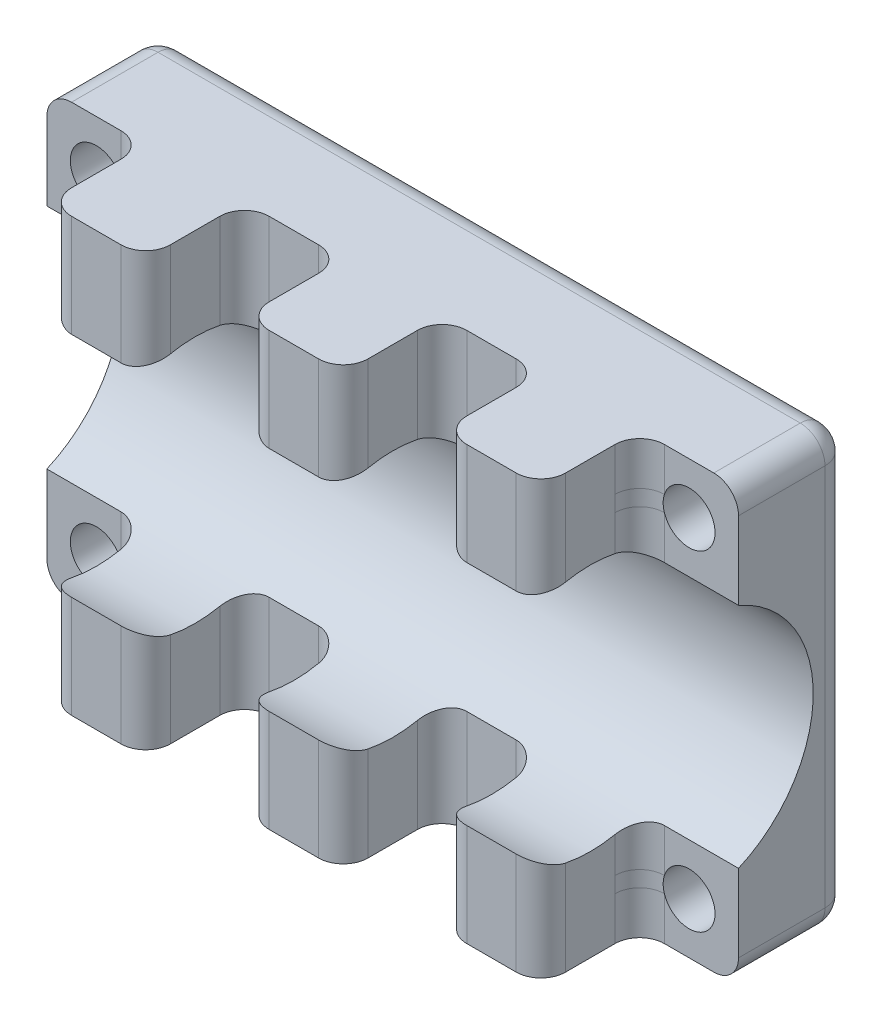
from build123d import *

# Parameters (mm, degrees)
SKETCH_1_W          = 56
SKETCH_1_H          = 35
EXTRUDE_1_DEPTH     = 26
SKETCH_2_R          = 10.05
CUT_EXTRUDE_1_DEPTH = 73
CUT_EXTRUDE_6_DEPTH = 41
SKETCH_6_R          = 2.1
CUT_EXTRUDE_7_DEPTH = 41
FILLET_3_R          = 2
FILLET_4_R          = 2


with BuildPart() as part:
    # 草图1 → 凸台-拉伸1 (new body)
    with BuildSketch(Plane.XY):
        with Locations((28, -17.5)):
            Rectangle(SKETCH_1_W, SKETCH_1_H)
    extrude(amount=EXTRUDE_1_DEPTH)

    # 草图2 → 切除-拉伸1 (cut)
    with BuildSketch(Plane(origin=(56, 0, 0), x_dir=(0, 0, -1), z_dir=(1, 0, 0))):
        with Locations(Location((-13, -17.5, 0), (0, 0, 90))):
            Circle(SKETCH_2_R)
    extrude(amount=-CUT_EXTRUDE_1_DEPTH, mode=Mode.SUBTRACT)

    # 草图3 → 切除-拉伸6 (cut)
    with BuildSketch(Plane(origin=(0, 0, 0), x_dir=(1, 0, 0), z_dir=(0, 1, 0))):
        Polygon((8, -9), (0, -9), (0, -26), (56, -26), (56, -9), (48, -9), (48, -17), (40, -17), (40, -9), (32, -9), (32, -17), (24, -17), (24, -9), (16, -9), (16, -17), (8, -17), align=None)
    extrude(amount=-CUT_EXTRUDE_6_DEPTH, mode=Mode.SUBTRACT)

    # 草图6 → 切除-拉伸7 (cut)
    with BuildSketch(Plane(origin=(0, 0, 0), x_dir=(-1, 0, 0), z_dir=(0, 0, -1))):
        with Locations((-4, -4.140159981)):
            Circle(SKETCH_6_R)
        with Locations((-52, -4.140159981)):
            Circle(SKETCH_6_R)
        with Locations(Location((-4, -30.859840019, 0), (0, 0, 180))):
            Circle(SKETCH_6_R)
        with Locations(Location((-52, -30.859840019, 0), (0, 0, 180))):
            Circle(SKETCH_6_R)
    extrude(amount=-CUT_EXTRUDE_7_DEPTH, mode=Mode.SUBTRACT)

    # 圆角3
    fillet_3_edges = [part.edges().sort_by_distance(p)[0] for p in [
        (48, -30.859840019, 9),
        (48, -4.140159981, 9),
        (8, -30.859840019, 9),
        (8, -4.140159981, 9),
        (8, -30.859840019, 17),
        (8, -4.140159981, 17),
        (16, -30.859840019, 17),
        (16, -4.140159981, 17),
        (16, -30.859840019, 9),
        (16, -4.140159981, 9),
        (24, -30.859840019, 9),
        (24, -4.140159981, 9),
        (24, -30.859840019, 17),
        (24, -4.140159981, 17),
        (32, -30.859840019, 17),
        (32, -4.140159981, 17),
        (32, -30.859840019, 9),
        (32, -4.140159981, 9),
        (40, -30.859840019, 9),
        (40, -4.140159981, 9),
        (40, -30.859840019, 17),
        (40, -4.140159981, 17),
        (48, -30.859840019, 17),
        (48, -4.140159981, 17),
    ]]
    fillet(fillet_3_edges, radius=FILLET_3_R)

    # 圆角4
    # the kernel refuses this fillet: 2 mm, written as the material it takes off along each edge
    with BuildSketch(Plane(origin=(2, -2, 2), x_dir=(0, 0, -1), z_dir=(0, 1, 0))) as fillet_4_piece_1_section:
        Polygon((0, 0), (FILLET_4_R, 0), (FILLET_4_R, FILLET_4_R), (0, FILLET_4_R), align=None)
    fillet_4_piece_1 = extrude(amount=FILLET_4_R, mode=Mode.PRIVATE)
    fillet_4_piece_1 = fillet_4_piece_1 - Plane(origin=(2, -2, 2), x_dir=(0.7071067811865475, 0, 0.7071067811865475), z_dir=(0, 1, 0)) * Sphere(FILLET_4_R, mode=Mode.PRIVATE)
    add(fillet_4_piece_1, mode=Mode.SUBTRACT)
    with BuildSketch(Plane(origin=(54, -2, 2), x_dir=(1, 0, 0), z_dir=(0, 1, 0))) as fillet_4_piece_2_section:
        Polygon((0, 0), (FILLET_4_R, 0), (FILLET_4_R, FILLET_4_R), (0, FILLET_4_R), align=None)
    fillet_4_piece_2 = extrude(amount=FILLET_4_R, mode=Mode.PRIVATE)
    fillet_4_piece_2 = fillet_4_piece_2 - Plane(origin=(54, -2, 2), x_dir=(-0.7071067811865475, 0, 0.7071067811865475), z_dir=(0, 1, 0)) * Sphere(FILLET_4_R, mode=Mode.PRIVATE)
    add(fillet_4_piece_2, mode=Mode.SUBTRACT)
    with BuildSketch(Plane(origin=(54, -33, 2), x_dir=(1, 0, 0), z_dir=(0, -1, 0))) as fillet_4_piece_3_section:
        Polygon((0, 0), (FILLET_4_R, 0), (FILLET_4_R, -FILLET_4_R), (0, -FILLET_4_R), align=None)
    fillet_4_piece_3 = extrude(amount=FILLET_4_R, mode=Mode.PRIVATE)
    fillet_4_piece_3 = fillet_4_piece_3 - Plane(origin=(54, -33, 2), x_dir=(-0.7071067811865475, 0, 0.7071067811865475), z_dir=(0, -1, 0)) * Sphere(FILLET_4_R, mode=Mode.PRIVATE)
    add(fillet_4_piece_3, mode=Mode.SUBTRACT)
    with BuildSketch(Plane(origin=(2, -33, 2), x_dir=(0, 0, -1), z_dir=(0, -1, 0))) as fillet_4_piece_4_section:
        Polygon((0, 0), (FILLET_4_R, 0), (FILLET_4_R, -FILLET_4_R), (0, -FILLET_4_R), align=None)
    fillet_4_piece_4 = extrude(amount=FILLET_4_R, mode=Mode.PRIVATE)
    fillet_4_piece_4 = fillet_4_piece_4 - Plane(origin=(2, -33, 2), x_dir=(0.7071067811865475, 0, 0.7071067811865475), z_dir=(0, -1, 0)) * Sphere(FILLET_4_R, mode=Mode.PRIVATE)
    add(fillet_4_piece_4, mode=Mode.SUBTRACT)
    with BuildSketch(Plane(origin=(0, 0, 2), x_dir=(1, 0, 0), z_dir=(0, 0, 1)), Plane(origin=(0, -35, 2), x_dir=(0, 1, 0), z_dir=(0, 0, 1))) as fillet_4_piece_5:
        with BuildLine():
            CenterArc((FILLET_4_R, -FILLET_4_R), FILLET_4_R, 90, 90)
            Line((0, -FILLET_4_R), (0, 0))
            Line((0, 0), (FILLET_4_R, 0))
        make_face()
    extrude(amount=12, mode=Mode.SUBTRACT)
    with BuildSketch(Plane(origin=(56, 0, 2), x_dir=(-1, 0, 0), z_dir=(0, 0, 1)), Plane(origin=(56, -35, 2), x_dir=(0, 1, 0), z_dir=(0, 0, 1))) as fillet_4_piece_6:
        with BuildLine():
            CenterArc((FILLET_4_R, FILLET_4_R), FILLET_4_R, 180, 90)
            Line((0, FILLET_4_R), (0, 0))
            Line((0, 0), (FILLET_4_R, 0))
        make_face()
    extrude(amount=12, mode=Mode.SUBTRACT)
    with BuildSketch(Plane(origin=(2, 0, 0), x_dir=(0, 0, 1), z_dir=(1, 0, 0))) as fillet_4_piece_7:
        with BuildLine():
            CenterArc((FILLET_4_R, FILLET_4_R), FILLET_4_R, 180, 90)
            Line((0, FILLET_4_R), (0, 0))
            Line((0, 0), (FILLET_4_R, 0))
        make_face()
    extrude(amount=52, mode=Mode.SUBTRACT)
    with BuildSketch(Plane(origin=(56, -2, 0), x_dir=(0, 0, 1), z_dir=(0, -1, 0))) as fillet_4_piece_8:
        with BuildLine():
            CenterArc((FILLET_4_R, FILLET_4_R), FILLET_4_R, 180, 90)
            Line((0, FILLET_4_R), (0, 0))
            Line((0, 0), (FILLET_4_R, 0))
        make_face()
    extrude(amount=31, mode=Mode.SUBTRACT)
    with BuildSketch(Plane(origin=(54, -35, 0), x_dir=(0, 1, 0), z_dir=(-1, 0, 0))) as fillet_4_piece_9:
        with BuildLine():
            CenterArc((FILLET_4_R, -FILLET_4_R), FILLET_4_R, 90, 90)
            Line((0, -FILLET_4_R), (0, 0))
            Line((0, 0), (FILLET_4_R, 0))
        make_face()
    extrude(amount=52, mode=Mode.SUBTRACT)
    with BuildSketch(Plane(origin=(0, -33, 0), x_dir=(1, 0, 0), z_dir=(0, 1, 0))) as fillet_4_piece_10:
        with BuildLine():
            CenterArc((FILLET_4_R, -FILLET_4_R), FILLET_4_R, 90, 90)
            Line((0, -FILLET_4_R), (0, 0))
            Line((0, 0), (FILLET_4_R, 0))
        make_face()
    extrude(amount=31, mode=Mode.SUBTRACT)


solid = part.part
